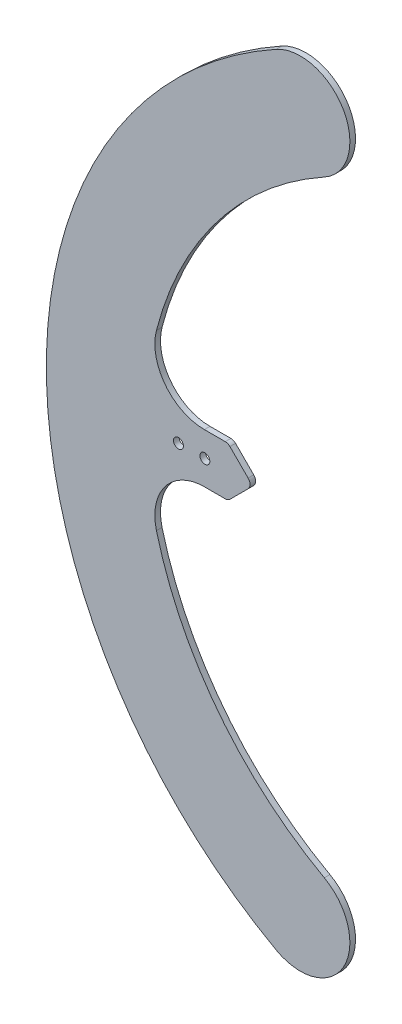
from build123d import *

# Parameters (mm, degrees)
SKETCH1_R           = 1.5
BOSS_EXTRUDE1_DEPTH = 1.7
FILLET1_R           = 15
FILLET2_R           = 2


with BuildPart() as part:
    # Sketch1 → Boss-Extrude1 (new body)
    with BuildSketch(Plane.XY):
        with BuildLine():
            ThreePointArc((7.143406631, -118.125000331), (27.530249949, -112.261843517), (21.667093666, -91.875000047))
            ThreePointArc((21.667093666, -91.875000047), (-15.986607167, -56.525395638), (-32.231800328, -7.5))
            Line((-32.231800328, -7.5), (-7.5, -7.5))
            Line((-7.5, -7.5), (0, 0))
            Line((0, 0), (-7.5, 7.5))
            Line((-7.5, 7.5), (-32.231800328, 7.5))
            ThreePointArc((-32.231800328, 7.5), (-15.986607261, 56.525395491), (21.66709336, 91.874999878))
            ThreePointArc((21.66709336, 91.874999878), (27.530250033, 112.261843365), (7.143406631, 118.125000331))
            ThreePointArc((7.143406631, 118.125000331), (-62.5, 0), (7.143406631, -118.125000331))
        make_face()
        with Locations((-22.5, 0)):
            Circle(SKETCH1_R, mode=Mode.SUBTRACT)
        with Locations((-14.5, 0)):
            Circle(SKETCH1_R, mode=Mode.SUBTRACT)
    extrude(amount=BOSS_EXTRUDE1_DEPTH)

    # Fillet1
    fillet1_edges = [part.edges().sort_by_distance(p)[0] for p in [
        (-32.231800328, -7.5, 0.85),
        (-32.231800328, 7.5, 0.85),
    ]]
    fillet(fillet1_edges, radius=FILLET1_R)

    # Fillet2
    fillet2_edges = [part.edges().sort_by_distance(p)[0] for p in [
        (-7.5, -7.5, 0.85),
        (-7.5, 7.5, 0.85),
        (0, 0, 0.85),
    ]]
    fillet(fillet2_edges, radius=FILLET2_R)


solid = part.part
